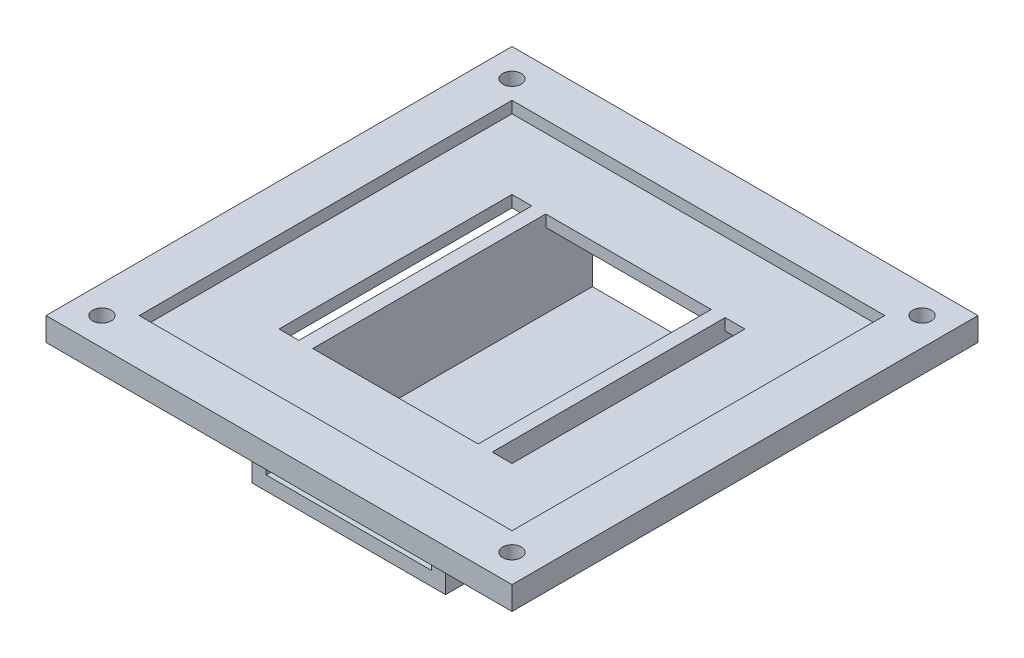
from build123d import *

# Parameters (mm, degrees)
SKETCH_2_W          = 100
SKETCH_2_H          = 100
SKETCH_2_R          = 2
SKETCH_2_W_2        = 50
SKETCH_2_H_2        = 50
EXTRUDE_1_DEPTH     = 2.5
EXTRUDE_4_DEPTH     = 35
SKETCH_7_W          = 80
SKETCH_7_H          = 80
CUT_EXTRUDE_1_DEPTH = 10


with BuildPart() as part:
    # 스케치2 → 보스-돌출1 (new, symmetric)
    with BuildSketch(Plane(origin=(0, 0, 0), x_dir=(1, 0, 0), z_dir=(0, 1, 0))):
        Rectangle(SKETCH_2_W, SKETCH_2_H)
        with Locations((-44, 44)):
            Circle(SKETCH_2_R, mode=Mode.SUBTRACT)
        with Locations((44, 44)):
            Circle(SKETCH_2_R, mode=Mode.SUBTRACT)
        with Locations((-44, -44)):
            Circle(SKETCH_2_R, mode=Mode.SUBTRACT)
        with Locations((44, -44)):
            Circle(SKETCH_2_R, mode=Mode.SUBTRACT)
        Rectangle(SKETCH_2_W_2, SKETCH_2_H_2, mode=Mode.SUBTRACT)
    extrude(amount=EXTRUDE_1_DEPTH, both=True)

    # 스케치6 → 보스-돌출4 (add, symmetric)
    with BuildSketch(Plane.XY):
        Polygon((-20.75, 0), (-20.75, -21.5), (20.75, -21.5), (20.75, 0), (17.75, 0), (17.75, -18.5), (-17.75, -18.5), (-17.75, 0), align=None)
    extrude(amount=EXTRUDE_4_DEPTH, both=True)

    # 스케치7 → 컷-돌출1 (cut)
    with BuildSketch(Plane(origin=(0, 0, 0), x_dir=(1, 0, 0), z_dir=(0, 1, 0))):
        Rectangle(SKETCH_7_W, SKETCH_7_H)
    extrude(amount=CUT_EXTRUDE_1_DEPTH, mode=Mode.SUBTRACT)


solid = part.part
